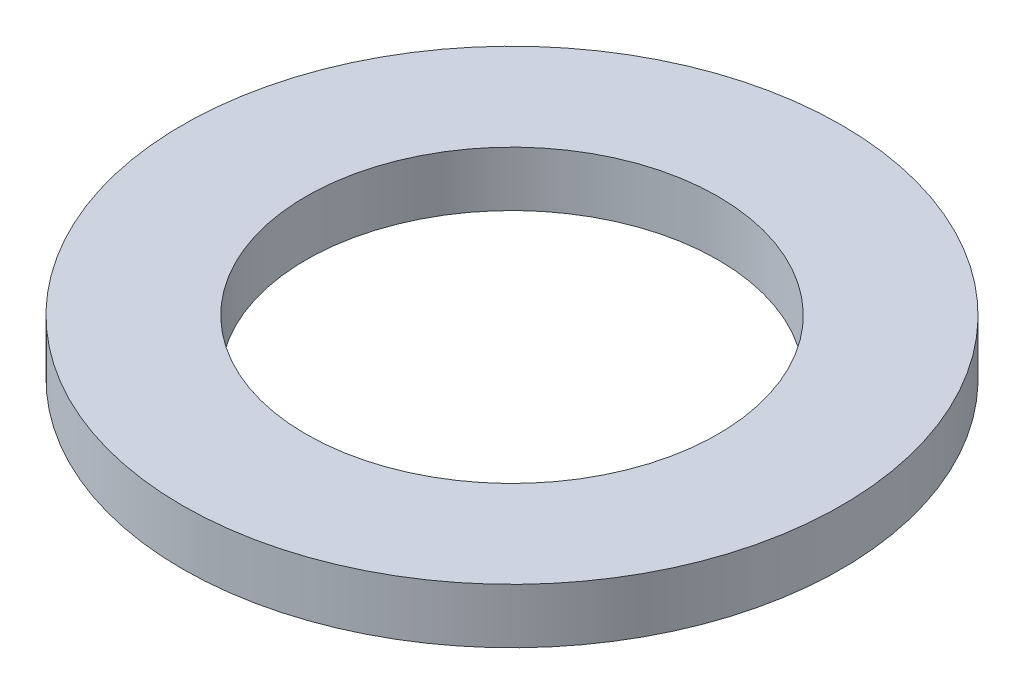
from build123d import *

# Parameters (mm, degrees)
SKETCH1_R           = 6
BOSS_EXTRUDE1_DEPTH = 1
CUT_EXTRUDE1_REACH  = 10.544
SKETCH2_R           = 3.75


with BuildPart() as part:
    # Sketch1 → Boss-Extrude1 (new body)
    with BuildSketch(Plane(origin=(0, 0, 0), x_dir=(1, 0, 0), z_dir=(0, 1, 0))):
        Circle(SKETCH1_R)
    extrude(amount=BOSS_EXTRUDE1_DEPTH)

    # Sketch2 → Cut-Extrude1 (cut, up to next)
    with BuildSketch(Plane(origin=(0, 1, 0), x_dir=(1, 0, 0), z_dir=(0, 1, 0)), mode=Mode.PRIVATE) as cut_extrude1_sk1:
        Circle(SKETCH2_R)
    cut_extrude1_tool1 = extrude(cut_extrude1_sk1.sketch, amount=-CUT_EXTRUDE1_REACH, mode=Mode.PRIVATE) & part.part
    add(cut_extrude1_tool1.solids().sort_by_distance((0, 1, 0))[0], mode=Mode.SUBTRACT)


solid = part.part
